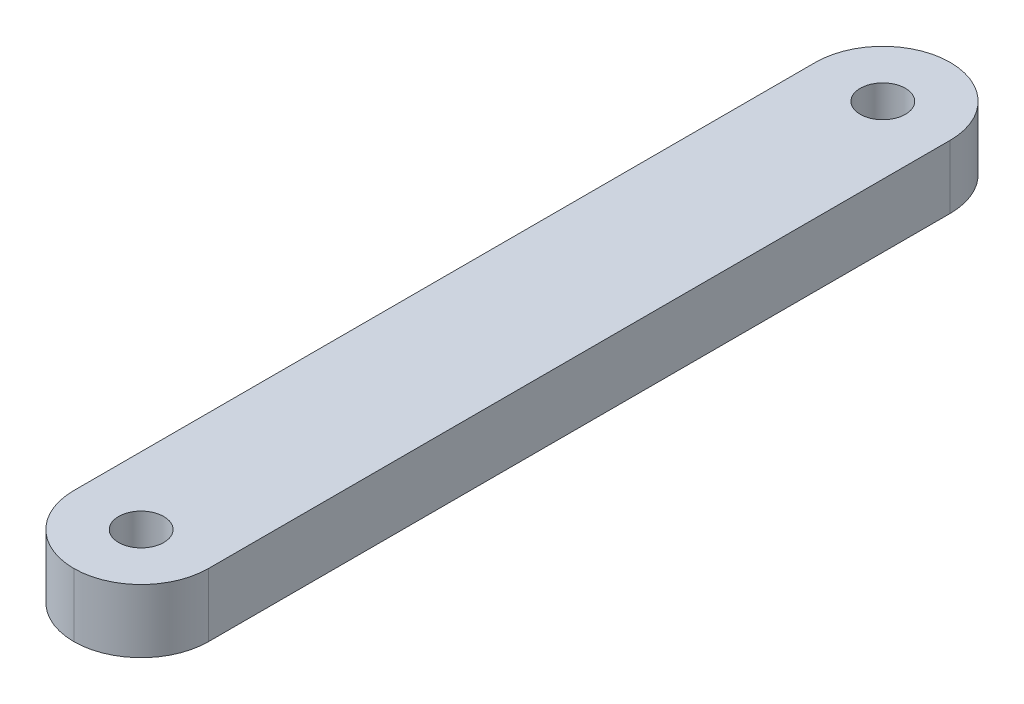
from build123d import *

# Parameters (mm, degrees)
SKETCH_1_W          = 10
SKETCH_1_H          = 5
EXTRUDE_1_DEPTH     = 65
SKETCH_2_R          = 1.675
CUT_EXTRUDE_1_DEPTH = 40
FILLET_1_R          = 5
SKETCH_3_W          = 36.824134977
SKETCH_3_H          = 78.201072097
CUT_EXTRUDE_2_DEPTH = 0.3


with BuildPart() as part:
    # 草图1 → 凸台-拉伸1 (new body)
    with BuildSketch(Plane.XY):
        with Locations((5, 2.5)):
            Rectangle(SKETCH_1_W, SKETCH_1_H)
    extrude(amount=EXTRUDE_1_DEPTH)

    # 草图2 → 切除-拉伸1 (cut)
    with BuildSketch(Plane(origin=(0, 5, 0), x_dir=(1, 0, 0), z_dir=(0, 1, 0))):
        with Locations(Location((5, -5, 0), (0, 0, 270))):
            Circle(SKETCH_2_R)
        with Locations(Location((5, -60, 0), (0, 0, 270))):
            Circle(SKETCH_2_R)
    extrude(amount=-CUT_EXTRUDE_1_DEPTH, mode=Mode.SUBTRACT)

    # 圆角1
    fillet_1_edges = [part.edges().sort_by_distance(p)[0] for p in [
        (0, 2.5, 65),
        (10, 2.5, 65),
        (0, 2.5, 0),
        (10, 2.5, 0),
    ]]
    fillet(fillet_1_edges, radius=FILLET_1_R - 0.0001)  # a hair under: the kernel refuses the full size

    # 草图3 → 切除-拉伸2 (cut)
    with BuildSketch(Plane(origin=(0, 5, 0), x_dir=(1, 0, 0), z_dir=(0, 1, 0))):
        with Locations((11.293579433, -34.071434458)):
            Rectangle(SKETCH_3_W, SKETCH_3_H)
    extrude(amount=-CUT_EXTRUDE_2_DEPTH, mode=Mode.SUBTRACT)


solid = part.part
